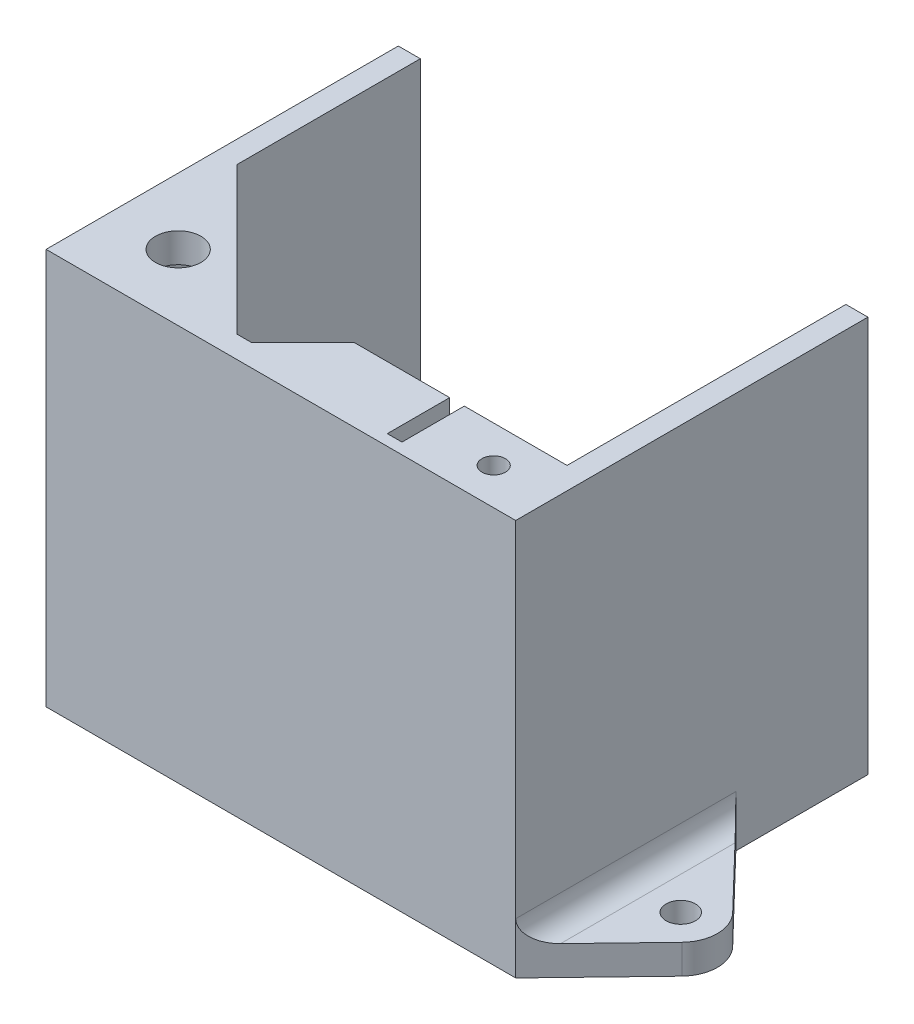
from build123d import *

# Parameters (mm, degrees)
SKETCH1_W           = 64
SKETCH1_H           = 48
BOSS_EXTRUDE1_DEPTH = 4
CUT_EXTRUDE1_DEPTH  = 2.4
CUT_EXTRUDE2_DEPTH  = 2.4
BOSS_EXTRUDE3_DEPTH = 50
BOSS_EXTRUDE4_DEPTH = 50
CUT_EXTRUDE4_DEPTH  = 9.5
SKETCH13_W          = 36.946258726
SKETCH13_H          = 1
CUT_EXTRUDE6_DEPTH  = 32
SKETCH15_R          = 3.1
BOSS_EXTRUDE5_DEPTH = 4
CUT_EXTRUDE7_DEPTH  = 7
SKETCH18_W          = 5.6
SKETCH18_H          = 2.5
CUT_EXTRUDE8_DEPTH  = 5
SKETCH19_W          = 6.595396426
SKETCH19_H          = 7.197552374
SKETCH19_R          = 1.6
BOSS_EXTRUDE8_DEPTH = 4.5
FILLET1_R           = 1.5
SKETCH20_R          = 2
BOSS_EXTRUDE9_DEPTH = 4
FILLET2_R           = 3
SKETCH22_R          = 1.65
CUT_EXTRUDE9_DEPTH  = 2


with BuildPart() as part:
    # Sketch1 → Boss-Extrude1 (new body)
    with BuildSketch(Plane(origin=(0, 0, 0), x_dir=(1, 0, 0), z_dir=(0, 1, 0))):
        Rectangle(SKETCH1_W, SKETCH1_H)
    extrude(amount=BOSS_EXTRUDE1_DEPTH)

    # Sketch2 → Cut-Extrude1 (cut)
    with BuildSketch(Plane.XZ):
        Polygon((-20.824573519, -16), (-22.41228676, -13.25), (-25.58771324, -13.25), (-27.175426481, -16), (-25.58771324, -18.75), (-22.41228676, -18.75), align=None)
    extrude(amount=-CUT_EXTRUDE1_DEPTH, mode=Mode.SUBTRACT)

    # Sketch4 → Cut-Extrude2 (cut)
    with BuildSketch(Plane.XZ):
        Polygon((9.175426481, 10), (7.58771324, 12.75), (4.41228676, 12.75), (2.824573519, 10), (4.41228676, 7.25), (7.58771324, 7.25), align=None)
    extrude(amount=-CUT_EXTRUDE2_DEPTH, mode=Mode.SUBTRACT)

    # Sketch6 → Boss-Extrude3 (add)
    with BuildSketch(Plane(origin=(0, 4, 0), x_dir=(1, 0, 0), z_dir=(0, 1, 0))):
        Polygon((-29, -21), (-29, 21), (-29, 24), (-32, 24), (-32, -24), (32, -24), (32, 24), (29, 24), (29, 21), (29, -21), align=None)
    extrude(amount=BOSS_EXTRUDE3_DEPTH)

    # Sketch9 → Boss-Extrude4 (add)
    with BuildSketch(Plane(origin=(0, 4, 0), x_dir=(1, 0, 0), z_dir=(0, 1, 0))):
        Polygon((29, -13), (1, -13), (-7, -21), (29, -21), align=None)
    extrude(amount=BOSS_EXTRUDE4_DEPTH)

    # Sketch10 → Cut-Extrude4 (cut)
    with BuildSketch(Plane(origin=(0, 0, 13), x_dir=(-1, 0, 0), z_dir=(0, 0, -1))):
        Polygon((-14.998616503, 39), (-27, 39), (-27, 13), (-1, 13), (-1, 39), (-13.001383497, 39), (-13.001383497, 54), (-14.998616503, 54), align=None)
    extrude(amount=-CUT_EXTRUDE4_DEPTH, mode=Mode.SUBTRACT)

    # Sketch13 → Cut-Extrude6 (cut)
    with BuildSketch(Plane(origin=(0, 54, 0), x_dir=(1, 0, 0), z_dir=(0, 1, 0))):
        with Locations((10.526870637, -13.5)):
            Rectangle(SKETCH13_W, SKETCH13_H)
    extrude(amount=-CUT_EXTRUDE6_DEPTH, mode=Mode.SUBTRACT)

    # Sketch15 → Boss-Extrude5 (add)
    with BuildSketch(Plane(origin=(0, 54, 0), x_dir=(1, 0, 0), z_dir=(0, 1, 0))):
        Polygon((-29, -1), (-9, -21), (-29, -21), align=None)
        with Locations((-23, -15)):
            Circle(SKETCH15_R, mode=Mode.SUBTRACT)
    extrude(amount=-BOSS_EXTRUDE5_DEPTH)

    # Sketch17 → Cut-Extrude7 (cut)
    with BuildSketch(Plane(origin=(0, 54, 0), x_dir=(1, 0, 0), z_dir=(0, 1, 0))):
        Polygon((24, -15.824573519), (21.25, -17.41228676), (21.25, -20.58771324), (24, -22.175426481), (26.75, -20.58771324), (26.75, -17.41228676), align=None)
    extrude(amount=-CUT_EXTRUDE7_DEPTH, mode=Mode.SUBTRACT)

    # Sketch18 → Cut-Extrude8 (cut)
    with BuildSketch(Plane(origin=(0, 0, 14), x_dir=(-1, 0, 0), z_dir=(0, 0, -1))):
        with Locations((-24, 48.25)):
            Rectangle(SKETCH18_W, SKETCH18_H)
    extrude(amount=-CUT_EXTRUDE8_DEPTH, mode=Mode.SUBTRACT)

    # Sketch19 → Boss-Extrude8 (add)
    with BuildSketch(Plane(origin=(0, 54, 0), x_dir=(1, 0, 0), z_dir=(0, 1, 0))):
        with Locations((24, -19)):
            Rectangle(SKETCH19_W, SKETCH19_H)
        with Locations((24, -19)):
            Circle(SKETCH19_R, mode=Mode.SUBTRACT)
    extrude(amount=-BOSS_EXTRUDE8_DEPTH)

    # Fillet1
    fillet1_edges = [part.edges().sort_by_distance(p)[0] for p in [
        (-29, 50, 11),
        (-19, 50, 21),
    ]]
    fillet(fillet1_edges, radius=FILLET1_R)

    # Sketch20 → Boss-Extrude9 (add)
    # profile 1 of 2: a face of its own
    with BuildSketch(Plane.XZ):
        with BuildLine():
            Line((43.102082828, 12.467708073), (32.000000003, 23.999999995))
            Line((32.000000003, 23.999999995), (32, -6.000000006))
            Line((32, -6.000000006), (43.102082826, 5.532291913))
            ThreePointArc((43.102082826, 5.532291913), (44.500000003, 8.999999993), (43.102082828, 12.467708073))
        make_face()
        with Locations((39.500000002, 8.999999994)):
            Circle(SKETCH20_R, mode=Mode.SUBTRACT)
    # profile 2 of 2: a face of its own
    with BuildSketch(Plane.XZ):
        with BuildLine():
            Line((-32, -24), (-32, 2.000000002))
            Line((-32, 2.000000002), (-42.978939192, -7.408763151))
            ThreePointArc((-42.978939192, -7.408763151), (-44.499999999, -10.999999999), (-42.978939192, -14.591236846))
            Line((-42.978939192, -14.591236846), (-32, -24))
        make_face()
        with Locations((-39.499999999, -10.999999999)):
            Circle(SKETCH20_R, mode=Mode.SUBTRACT)
    extrude(amount=-BOSS_EXTRUDE9_DEPTH)

    # Fillet2
    fillet2_edges = [part.edges().sort_by_distance(p)[0] for p in [
        (-32, 4, -10.999999999),
        (32.000000002, 4, 8.999999995),
    ]]
    fillet(fillet2_edges, radius=FILLET2_R)

    # Sketch22 → Cut-Extrude9 (cut)
    with BuildSketch(Plane.XZ.offset(-2.4)):
        with Locations((-24, -16)):
            Circle(SKETCH22_R)
        with Locations((6, 10)):
            Circle(SKETCH22_R)
    extrude(amount=-CUT_EXTRUDE9_DEPTH, mode=Mode.SUBTRACT)


solid = part.part
